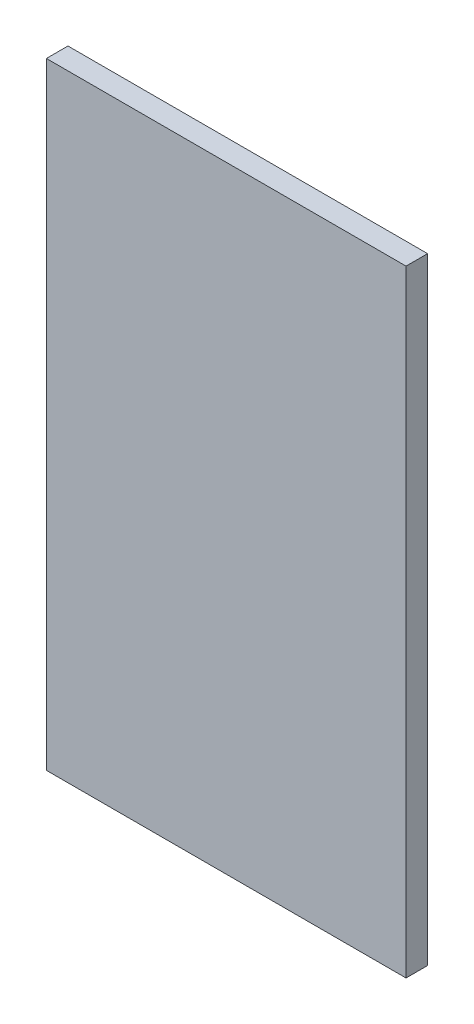
from build123d import *

# Parameters (mm, degrees)
SKETCH2_W           = 88.9
SKETCH2_H           = 152.4
BOSS_EXTRUDE2_DEPTH = 5.334


with BuildPart() as part:
    # Sketch2 → Boss-Extrude2 (new body)
    with BuildSketch(Plane.XY):
        Rectangle(SKETCH2_W, SKETCH2_H)
    extrude(amount=BOSS_EXTRUDE2_DEPTH)


solid = part.part
